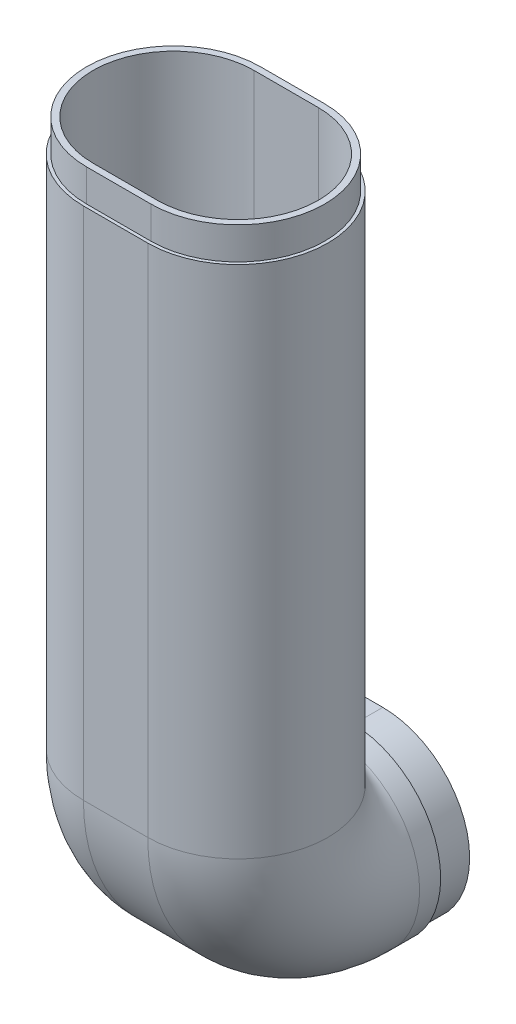
from build123d import *

# Parameters (mm, degrees)
BOSS_EXTRUDE1_DEPTH = 12
SWEEP1_START        = 12
SWEEP1_DEPTH        = 4.545750983
SWEEP1_2_ANGLE      = 90
BOSS_EXTRUDE2_DEPTH = 170
SKETCH11_W          = 78
SKETCH11_H          = 58
CUT_EXTRUDE14_DEPTH = 10
SKETCH12_W          = 78
SKETCH12_H          = 58
CUT_EXTRUDE15_DEPTH = 10


with BuildPart() as part:
    # Sketch1 → Boss-Extrude1 (new body)
    with BuildSketch(Plane.XY):
        with BuildLine():
            Line((10, -28), (-10, -28))
            ThreePointArc((-10, -28), (-38, 0), (-10, 28))
            Line((-10, 28), (10, 28))
            ThreePointArc((10, 28), (38, 0), (10, -28))
        make_face()
        with BuildLine():
            Line((10, -25), (-10, -25))
            ThreePointArc((-10, -25), (-35, 0), (-10, 25))
            Line((-10, 25), (10, 25))
            ThreePointArc((10, 25), (35, 0), (10, -25))
        make_face(mode=Mode.SUBTRACT)
    extrude(amount=BOSS_EXTRUDE1_DEPTH)

    # Sweep1: read off the stored shape, not the designer's step
    # Sweep1 outline → Sweep1 (add)
    with BuildSketch(Plane.XY.offset(SWEEP1_START)):
        with BuildLine():
            ThreePointArc((-10, 28), (-38, 0), (-10, -28))
            Line((-10, -28), (10, -28))
            ThreePointArc((10, -28), (38, 0), (10, 28))
            Line((10, 28), (-10, 28))
        make_face()
        with BuildLine():
            Line((10, -25), (-10, -25))
            ThreePointArc((-10, -25), (-35, 0), (-10, 25))
            Line((-10, 25), (10, 25))
            ThreePointArc((10, 25), (35, 0), (10, -25))
        make_face(mode=Mode.SUBTRACT)
    extrude(amount=SWEEP1_DEPTH)

    # Sweep1 2 outline → Sweep1 2 (revolve)
    with BuildSketch(Plane(origin=(0, 28.510163598, 16.545750983), x_dir=(0, 0, 1), z_dir=(0, 1, 0))):
        with BuildLine():
            Line((0.510163598, 10), (0.510163598, -10))
            ThreePointArc((0.510163598, -10), (28.510163598, -38), (56.510163598, -10))
            Line((56.510163598, -10), (56.510163598, 10))
            ThreePointArc((56.510163598, 10), (28.510163598, 38), (0.510163598, 10))
        make_face()
        with BuildLine():
            Line((3.510163598, -10), (3.510163598, 10))
            ThreePointArc((3.510163598, 10), (28.510163598, 35), (53.510163598, 10))
            Line((53.510163598, 10), (53.510163598, -10))
            ThreePointArc((53.510163598, -10), (28.510163598, -35), (3.510163598, -10))
        make_face(mode=Mode.SUBTRACT)
    revolve(axis=Axis((0, 28.510163598, 16.545750983), (1, 0, 0)), revolution_arc=SWEEP1_2_ANGLE)

    # Sketch6 → Boss-Extrude2 (add)
    with BuildSketch(Plane(origin=(0, 28.510163598, 0), x_dir=(1, 0, 0), z_dir=(0, 1, 0))):
        with BuildLine():
            Line((10, -73.055914581), (-10, -73.055914581))
            ThreePointArc((-10, -73.055914581), (-38, -45.055914581), (-10, -17.055914581))
            Line((-10, -17.055914581), (10, -17.055914581))
            ThreePointArc((10, -17.055914581), (38, -45.055914581), (10, -73.055914581))
        make_face()
        with BuildLine():
            Line((10, -70.055914581), (-10, -70.055914581))
            ThreePointArc((-10, -70.055914581), (-35, -45.055914581), (-10, -20.055914581))
            Line((-10, -20.055914581), (10, -20.055914581))
            ThreePointArc((10, -20.055914581), (35, -45.055914581), (10, -70.055914581))
        make_face(mode=Mode.SUBTRACT)
    extrude(amount=BOSS_EXTRUDE2_DEPTH)

    # Sketch11 → Cut-Extrude14 (cut)
    with BuildSketch(Plane(origin=(0, 0, 0), x_dir=(-1, 0, 0), z_dir=(0, 0, -1))):
        Rectangle(SKETCH11_W, SKETCH11_H)
        with BuildLine():
            Line((10, -27), (-10, -27))
            ThreePointArc((-10, -27), (-37, 0), (-10, 27))
            Line((-10, 27), (10, 27))
            ThreePointArc((10, 27), (37, 0), (10, -27))
        make_face(mode=Mode.SUBTRACT)
    extrude(amount=-CUT_EXTRUDE14_DEPTH, mode=Mode.SUBTRACT)

    # Sketch12 → Cut-Extrude15 (cut)
    with BuildSketch(Plane(origin=(0, 198.510163598, 0), x_dir=(1, 0, 0), z_dir=(0, 1, 0))):
        with Locations((0, -45.055914581)):
            Rectangle(SKETCH12_W, SKETCH12_H)
        with BuildLine():
            Line((10, -72.055914581), (-10, -72.055914581))
            ThreePointArc((-10, -72.055914581), (-37, -45.055914581), (-10, -18.055914581))
            Line((-10, -18.055914581), (10, -18.055914581))
            ThreePointArc((10, -18.055914581), (37, -45.055914581), (10, -72.055914581))
        make_face(mode=Mode.SUBTRACT)
    extrude(amount=-CUT_EXTRUDE15_DEPTH, mode=Mode.SUBTRACT)


solid = part.part
